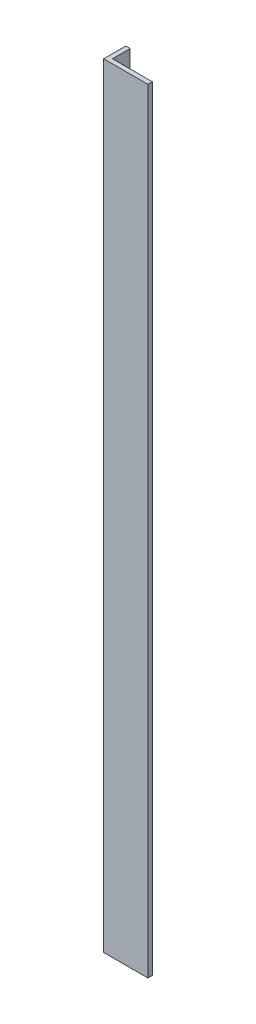
from build123d import *

# Parameters (mm, degrees)
BOSS_EXTRUDE1_DEPTH      = 350
F_3_0_3_DIAMETER_HOLE1_D = 3
F_3_0_3_DIAMETER_HOLE2_D = 3


with BuildPart() as part:
    # Sketch1 → Boss-Extrude1 (new body)
    with BuildSketch(Plane(origin=(0, 0, 0), x_dir=(1, 0, 0), z_dir=(0, 1, 0))):
        Polygon((0, 0), (0, 10), (2, 10), (2, 2), (20, 2), (20, 0), align=None)
    extrude(amount=BOSS_EXTRUDE1_DEPTH)

    # Ø3.0 (3) Diameter Hole1 (through all)
    with Locations(Plane(origin=(2, -11.407632793, -188.67995168), x_dir=(0, 0, -1), z_dir=(1, 0, 0))):
        with Locations((-182.67995168, 17.407632793), (-182.67995168, 31.407632793)):
            Hole(F_3_0_3_DIAMETER_HOLE1_D / 2)

    # Ø3.0 (3) Diameter Hole2 (through all)
    with Locations(Plane(origin=(2, -11.407632793, -188.67995168), x_dir=(0, 0, -1), z_dir=(1, 0, 0))):
        with Locations((-182.67995168, 355.407632793), (-182.67995168, 341.407632793)):
            Hole(F_3_0_3_DIAMETER_HOLE2_D / 2)


solid = part.part
